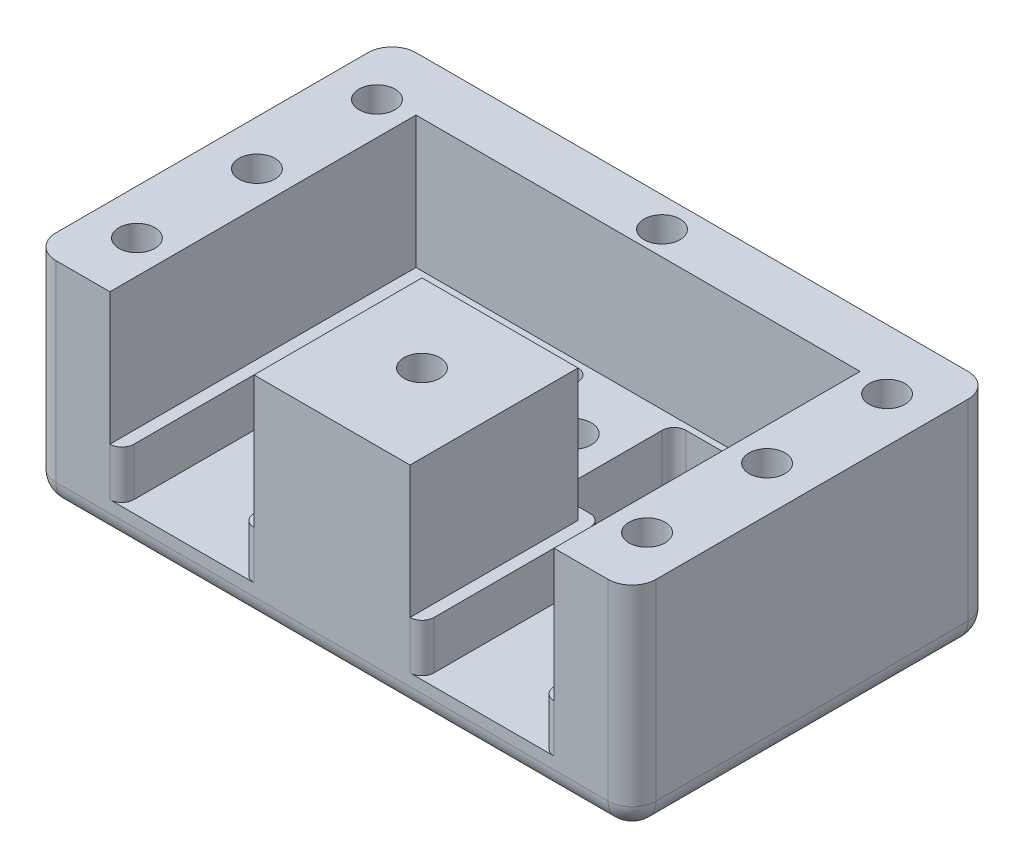
from build123d import *

# Parameters (mm, degrees)
SKETCH_1_W          = 50
SKETCH_1_H          = 30
EXTRUDE_1_DEPTH     = 7
SKETCH_2_W          = 10
SKETCH_2_H          = 25
CUT_EXTRUDE_1_DEPTH = 4
SKETCH_4_R          = 1.6
CUT_EXTRUDE_3_DEPTH = 30.983328701
SKETCH_5_R          = 3
CUT_EXTRUDE_4_DEPTH = 3
SKETCH_6_R          = 1.5
CUT_EXTRUDE_5_DEPTH = 30.983328701
SKETCH_7_W          = 13
SKETCH_7_H          = 14
EXTRUDE_6_DEPTH     = 11
SKETCH_8_R          = 1.5
CUT_EXTRUDE_6_DEPTH = 32.160872902
SKETCH_9_R          = 1.5
CUT_EXTRUDE_7_DEPTH = 35.263683398
FILLET_1_R          = 2
SKETCH_10_W         = 4
SKETCH_10_H         = 10
CUT_EXTRUDE_8_DEPTH = 4
FILLET_2_R          = 1
FILLET_3_R          = 1


with BuildPart() as part:
    # Эскиз1 → Бобышка-Вытянуть1 (new body)
    with BuildSketch(Plane(origin=(0, 0, 0), x_dir=(1, 0, 0), z_dir=(0, 1, 0))):
        Rectangle(SKETCH_1_W, SKETCH_1_H)
    extrude(amount=EXTRUDE_1_DEPTH)

    # Эскиз2 → Вырез-Вытянуть1 (cut)
    with BuildSketch(Plane(origin=(0, 7, 0), x_dir=(1, 0, 0), z_dir=(0, 1, 0))):
        with Locations((-12.5, -2.5)):
            Rectangle(SKETCH_2_W, SKETCH_2_H)
        with Locations((12.5, -2.5)):
            Rectangle(SKETCH_2_W, SKETCH_2_H)
    extrude(amount=-CUT_EXTRUDE_1_DEPTH, mode=Mode.SUBTRACT)

    # Эскиз4 → Вырез-Вытянуть3 (cut, through all)
    with BuildSketch(Plane(origin=(0, 7, 0), x_dir=(1, 0, 0), z_dir=(0, 1, 0))):
        with Locations(Location((0, 5, 0), (0, 0, 270))):
            Circle(SKETCH_4_R)
    extrude(amount=-CUT_EXTRUDE_3_DEPTH, mode=Mode.SUBTRACT)

    # Эскиз5 → Вырез-Вытянуть4 (cut)
    with BuildSketch(Plane.XZ):
        with Locations(Location((0, -5, 0), (0, 0, 270))):
            Circle(SKETCH_5_R)
    extrude(amount=-CUT_EXTRUDE_4_DEPTH, mode=Mode.SUBTRACT)

    # Эскиз6 → Вырез-Вытянуть5 (cut, through all)
    with BuildSketch(Plane(origin=(0, 7, 0), x_dir=(1, 0, 0), z_dir=(0, 1, 0))):
        with Locations(Location((-21.25, 0, 0), (0, 0, 270))):
            Circle(SKETCH_6_R)
        with Locations(Location((0, 12.5, 0), (0, 0, 270))):
            Circle(SKETCH_6_R)
        with Locations(Location((21.25, 0, 0), (0, 0, 270))):
            Circle(SKETCH_6_R)
        with Locations(Location((0, -7.5, 0), (0, 0, 270))):
            Circle(SKETCH_6_R)
    extrude(amount=-CUT_EXTRUDE_5_DEPTH, mode=Mode.SUBTRACT)

    # Эскиз7 → Бобышка-Вытянуть6 (add)
    with BuildSketch(Plane(origin=(0, 7, 0), x_dir=(1, 0, 0), z_dir=(0, 1, 0))):
        Polygon((-25, 15), (25, 15), (25, -15), (18.5, -15), (18.5, 10.5), (-18.5, 10.5), (-18.5, -15), (-25, -15), align=None)
        with Locations((0, -8)):
            Rectangle(SKETCH_7_W, SKETCH_7_H)
    extrude(amount=EXTRUDE_6_DEPTH)

    # Эскиз8 → Вырез-Вытянуть6 (cut, through all)
    with BuildSketch(Plane.XZ.offset(-7)):
        with Locations(Location((21.25, 0, 0), (0, 0, 90))):
            Circle(SKETCH_8_R)
        with Locations(Location((0, 7.5, 0), (0, 0, 90))):
            Circle(SKETCH_8_R)
        with Locations(Location((-21.25, 0, 0), (0, 0, 90))):
            Circle(SKETCH_8_R)
        with Locations(Location((0, -12.5, 0), (0, 0, 90))):
            Circle(SKETCH_8_R)
    extrude(amount=-CUT_EXTRUDE_6_DEPTH, mode=Mode.SUBTRACT)

    # Эскиз9 → Вырез-Вытянуть7 (cut, through all)
    with BuildSketch(Plane(origin=(0, 18, 0), x_dir=(1, 0, 0), z_dir=(0, 1, 0))):
        with Locations(Location((-21.25, 10, 0), (0, 0, 270))):
            Circle(SKETCH_9_R)
        with Locations(Location((21.25, 10, 0), (0, 0, 270))):
            Circle(SKETCH_9_R)
        with Locations(Location((21.25, -10, 0), (0, 0, 270))):
            Circle(SKETCH_9_R)
        with Locations(Location((-21.25, -10, 0), (0, 0, 270))):
            Circle(SKETCH_9_R)
    extrude(amount=-CUT_EXTRUDE_7_DEPTH, mode=Mode.SUBTRACT)

    # Скругление1
    # the kernel refuses this fillet: 2 mm, written as the material it takes off along each edge
    with BuildSketch(Plane(origin=(-23, 2, -13), x_dir=(0, -1, 0), z_dir=(-1, 0, 0))) as fillet_1_piece_1_section:
        Polygon((0, 0), (FILLET_1_R, 0), (FILLET_1_R, -FILLET_1_R), (0, -FILLET_1_R), align=None)
    fillet_1_piece_1 = extrude(amount=FILLET_1_R, mode=Mode.PRIVATE)
    fillet_1_piece_1 = fillet_1_piece_1 - Plane(origin=(-23, 2, -13), x_dir=(0, 0.7071067811865475, 0.7071067811865475), z_dir=(-1, 0, 0)) * Sphere(FILLET_1_R, mode=Mode.PRIVATE)
    add(fillet_1_piece_1, mode=Mode.SUBTRACT)
    with BuildSketch(Plane(origin=(23, 2, -13), x_dir=(1, 0, 0), z_dir=(0, -1, 0))) as fillet_1_piece_2_section:
        Polygon((0, 0), (FILLET_1_R, 0), (FILLET_1_R, -FILLET_1_R), (0, -FILLET_1_R), align=None)
    fillet_1_piece_2 = extrude(amount=FILLET_1_R, mode=Mode.PRIVATE)
    fillet_1_piece_2 = fillet_1_piece_2 - Plane(origin=(23, 2, -13), x_dir=(-0.7071067811865474, 0, 0.7071067811865477), z_dir=(0, -1, 0)) * Sphere(FILLET_1_R, mode=Mode.PRIVATE)
    add(fillet_1_piece_2, mode=Mode.SUBTRACT)
    with BuildSketch(Plane(origin=(23, 2, 13), x_dir=(0, -1, 0), z_dir=(0, 0, 1))) as fillet_1_piece_3_section:
        Polygon((0, 0), (FILLET_1_R, 0), (FILLET_1_R, FILLET_1_R), (0, FILLET_1_R), align=None)
    fillet_1_piece_3 = extrude(amount=FILLET_1_R, mode=Mode.PRIVATE)
    fillet_1_piece_3 = fillet_1_piece_3 - Plane(origin=(23, 2, 13), x_dir=(-0.7071067811865475, 0.7071067811865475, 0), z_dir=(0, 0, 1)) * Sphere(FILLET_1_R, mode=Mode.PRIVATE)
    add(fillet_1_piece_3, mode=Mode.SUBTRACT)
    with BuildSketch(Plane(origin=(-23, 2, 13), x_dir=(0, -1, 0), z_dir=(0, 0, 1))) as fillet_1_piece_4_section:
        Polygon((0, 0), (FILLET_1_R, 0), (FILLET_1_R, -FILLET_1_R), (0, -FILLET_1_R), align=None)
    fillet_1_piece_4 = extrude(amount=FILLET_1_R, mode=Mode.PRIVATE)
    fillet_1_piece_4 = fillet_1_piece_4 - Plane(origin=(-23, 2, 13), x_dir=(0.7071067811865475, 0.7071067811865475, 0), z_dir=(0, 0, 1)) * Sphere(FILLET_1_R, mode=Mode.PRIVATE)
    add(fillet_1_piece_4, mode=Mode.SUBTRACT)
    with BuildSketch(Plane(origin=(-23, 0, -15), x_dir=(0, 0, 1), z_dir=(1, 0, 0))) as fillet_1_piece_5:
        with BuildLine():
            CenterArc((FILLET_1_R, -FILLET_1_R), FILLET_1_R, 90, 90)
            Line((0, -FILLET_1_R), (0, 0))
            Line((0, 0), (FILLET_1_R, 0))
        make_face()
    extrude(amount=46, mode=Mode.SUBTRACT)
    with BuildSketch(Plane(origin=(25, 0, -13), x_dir=(-1, 0, 0), z_dir=(0, 0, 1)), Plane(origin=(-25, 0, 13), x_dir=(1, 0, 0), z_dir=(0, 0, -1))) as fillet_1_piece_6:
        with BuildLine():
            CenterArc((FILLET_1_R, -FILLET_1_R), FILLET_1_R, 90, 90)
            Line((0, -FILLET_1_R), (0, 0))
            Line((0, 0), (FILLET_1_R, 0))
        make_face()
    extrude(amount=26, mode=Mode.SUBTRACT)
    with BuildSketch(Plane(origin=(23, 0, 15), x_dir=(0, 1, 0), z_dir=(-1, 0, 0))) as fillet_1_piece_7:
        with BuildLine():
            CenterArc((FILLET_1_R, FILLET_1_R), FILLET_1_R, 180, 90)
            Line((0, FILLET_1_R), (0, 0))
            Line((0, 0), (FILLET_1_R, 0))
        make_face()
    extrude(amount=46, mode=Mode.SUBTRACT)
    with BuildSketch(Plane(origin=(-25, 23, -15), x_dir=(0, 0, 1), z_dir=(0, -1, 0)), Plane(origin=(25, 2, -15), x_dir=(0, 0, 1), z_dir=(0, 1, 0)), Plane(origin=(25, 2, 15), x_dir=(-1, 0, 0), z_dir=(0, 1, 0)), Plane(origin=(-25, 23, 15), x_dir=(1, 0, 0), z_dir=(0, -1, 0))) as fillet_1_piece_8:
        with BuildLine():
            CenterArc((FILLET_1_R, -FILLET_1_R), FILLET_1_R, 90, 90)
            Line((0, -FILLET_1_R), (0, 0))
            Line((0, 0), (FILLET_1_R, 0))
        make_face()
    extrude(amount=21, mode=Mode.SUBTRACT)

    # Эскиз10 → Вырез-Вытянуть8 (cut)
    with BuildSketch(Plane(origin=(0, 7, 0), x_dir=(1, 0, 0), z_dir=(0, 1, 0))):
        with Locations((-5.5, 5)):
            Rectangle(SKETCH_10_W, SKETCH_10_H)
        with Locations((5.5, 5)):
            Rectangle(SKETCH_10_W, SKETCH_10_H)
    extrude(amount=-CUT_EXTRUDE_8_DEPTH, mode=Mode.SUBTRACT)

    # Скругление2
    fillet_2_edges = [part.edges().sort_by_distance(p)[0] for p in [
        (-7.5, 5, 0),
        (-3.5, 5, -10),
        (-3.5, 5, 0),
        (7.5, 5, 0),
        (3.5, 5, 0),
        (3.5, 5, -10),
    ]]
    fillet(fillet_2_edges, radius=FILLET_2_R)

    # Скругление3
    fillet_3_edges = [part.edges().sort_by_distance(p)[0] for p in [
        (17.5, 5, -10),
        (17.5, 5, 15),
        (7.5, 5, 15),
        (-7.5, 5, 15),
        (-17.5, 5, 15),
        (-17.5, 5, -10),
    ]]
    fillet(fillet_3_edges, radius=FILLET_3_R)


solid = part.part
